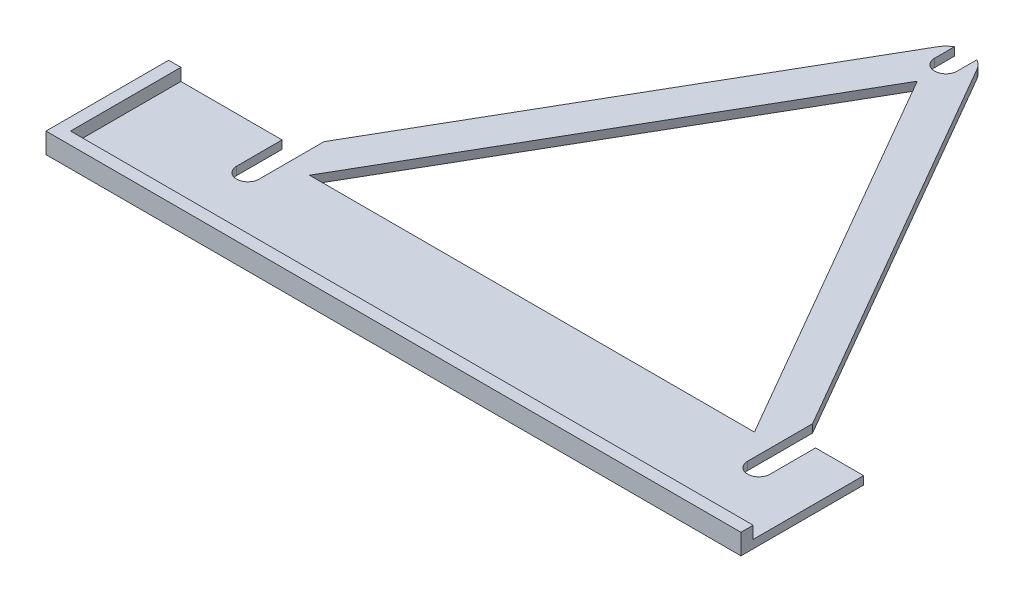
from build123d import *

# Parameters (mm, degrees)
SKETCH1_R               = 2.75
BOSS_EXTRUDE4_DEPTH     = 2
BOSS_EXTRUDE7_DEPTH     = 5
CUT_EXTRUDE1_DEPTH      = 119.266647877
CUT_EXTRUDE1_DEPTH_BACK = 119.266647877


with BuildPart() as part:
    # Sketch1 → Boss-Extrude4 (new body)
    with BuildSketch(Plane(origin=(0, 0, 0), x_dir=(1, 0, 0), z_dir=(0, 1, 0))):
        with BuildLine():
            Line((77, -43), (62.5, -43))
            Line((62.5, -43), (4.817953819, 56.908234671))
            ThreePointArc((4.817953819, 56.908234671), (0, 59.689881605), (-4.817953819, 56.908234671))
            Line((-4.817953819, 56.908234671), (-62.5, -43))
            Line((-62.5, -43), (-90, -43))
            Line((-90, -43), (-90, -70))
            Line((-90, -70), (77, -70))
            Line((77, -70), (77, -43))
        make_face()
        with Locations((-62.5, -54.126587737)):
            Circle(SKETCH1_R, mode=Mode.SUBTRACT)
        with Locations((62.5, -54.126587737)):
            Circle(SKETCH1_R, mode=Mode.SUBTRACT)
        Polygon((54.417096231, -47.126587737), (-54.417096231, -47.126587737), (0, 47.126587737), align=None, mode=Mode.SUBTRACT)
        with Locations((0, 54.126587737)):
            Circle(SKETCH1_R, mode=Mode.SUBTRACT)
    extrude(amount=BOSS_EXTRUDE4_DEPTH)

    # Sketch1<6> → Boss-Extrude7 (add)
    with BuildSketch(Plane(origin=(0, 0, 0), x_dir=(1, 0, 0), z_dir=(0, 1, 0))):
        Polygon((77, -73), (77, -70), (-90, -70), (-90, -43), (-93, -43), (-93, -73), align=None)
    extrude(amount=BOSS_EXTRUDE7_DEPTH)

    # Sketch2 → Cut-Extrude1 (cut, two sides: drawn at the far end of the back side and taken through both)
    with BuildSketch(Plane(origin=(0, 2, 0), x_dir=(1, 0, 0), z_dir=(0, 1, 0)).offset(-CUT_EXTRUDE1_DEPTH_BACK)):
        with BuildLine():
            Line((-2.75, 54.126587737), (-2.75, 58.96267486))
            ThreePointArc((-2.75, 58.96267486), (0, 59.689881605), (2.75, 58.96267486))
            Line((2.75, 58.96267486), (2.75, 54.126587737))
            ThreePointArc((2.75, 54.126587737), (0, 51.376587737), (-2.75, 54.126587737))
        make_face()
        with BuildLine():
            Line((-65.25, -54.126587737), (-65.25, -43))
            Line((-65.25, -43), (-62.5, -43))
            Line((-62.5, -43), (-59.75, -38.236860279))
            Line((-59.75, -38.236860279), (-59.75, -54.126587737))
            ThreePointArc((-59.75, -54.126587737), (-62.5, -56.876587737), (-65.25, -54.126587737))
        make_face()
        with BuildLine():
            Line((65.25, -54.126587737), (65.25, -43))
            Line((65.25, -43), (62.5, -43))
            Line((62.5, -43), (59.75, -38.236860279))
            Line((59.75, -38.236860279), (59.75, -54.126587737))
            ThreePointArc((59.75, -54.126587737), (62.5, -56.876587737), (65.25, -54.126587737))
        make_face()
    extrude(amount=CUT_EXTRUDE1_DEPTH + CUT_EXTRUDE1_DEPTH_BACK, mode=Mode.SUBTRACT)


solid = part.part
